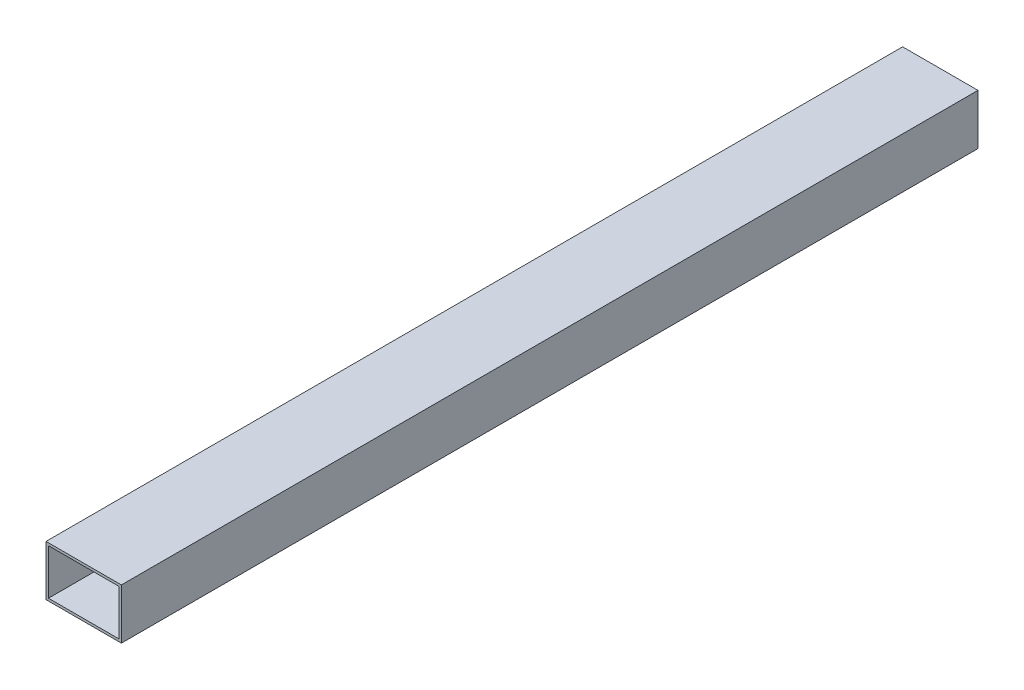
from build123d import *

# Parameters (mm, degrees)
CROQUIS2_W              = 76.2
CROQUIS2_H              = 51
SALIENTE_EXTRUIR1_DEPTH = 433
CROQUIS6_W              = 71.2
CROQUIS6_H              = 46
CORTAR_EXTRUIR1_DEPTH   = 900


with BuildPart() as part:
    # Croquis2 → Saliente-Extruir1 (new, symmetric)
    with BuildSketch(Plane.XY):
        Rectangle(CROQUIS2_W, CROQUIS2_H)
    extrude(amount=SALIENTE_EXTRUIR1_DEPTH, both=True)

    # Croquis6 → Cortar-Extruir1 (cut)
    with BuildSketch(Plane.XY.offset(433)):
        Rectangle(CROQUIS6_W, CROQUIS6_H)
    extrude(amount=-CORTAR_EXTRUIR1_DEPTH, mode=Mode.SUBTRACT)


solid = part.part
